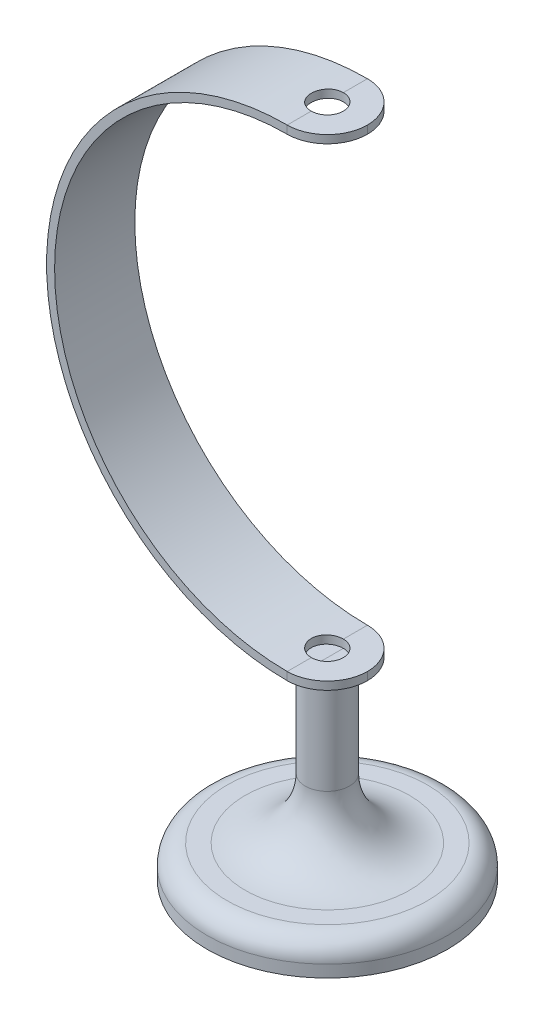
from build123d import *

# Parameters (mm, degrees)
BOSS_EXTRUDE1_DEPTH     = 10
CUT_EXTRUDE1_DEPTH      = 135.536240471
CUT_EXTRUDE1_DEPTH_BACK = 135.536240471
SKETCH3_R               = 4
FILLET1_R               = 10
BOSS_EXTRUDE2_OUTLINE_R = 5.5
BOSS_EXTRUDE2_DEPTH     = 40
BOSS_EXTRUDE2_START     = -5.5
BOSS_EXTRUDE2_2_DEPTH   = 11
SKETCH5_R               = 30
BOSS_EXTRUDE3_DEPTH     = 8
FILLET2_R               = 15
FILLET3_R               = 5


with BuildPart() as part:
    # Sketch2 → Boss-Extrude1 (new, symmetric)
    with BuildSketch(Plane.XY):
        with BuildLine():
            Line((0, 60), (10, 60))
            Line((10, 60), (10, 58))
            Line((10, 58), (0, 58))
            ThreePointArc((0, 58), (-58, 0), (0, -58))
            Line((0, -58), (10, -58))
            Line((10, -58), (10, -60))
            Line((10, -60), (0, -60))
            ThreePointArc((0, -60), (-60, 0), (0, 60))
        make_face()
    extrude(amount=BOSS_EXTRUDE1_DEPTH, both=True)

    # Sketch3 → Cut-Extrude1 (cut, two sides: drawn at the far end of the back side and taken through both)
    with BuildSketch(Plane(origin=(0, 60, 0), x_dir=(1, 0, 0), z_dir=(0, 1, 0)).offset(-CUT_EXTRUDE1_DEPTH_BACK)):
        with Locations(Location((0, 0, 0), (0, 0, 270))):
            Circle(SKETCH3_R)
    extrude(amount=CUT_EXTRUDE1_DEPTH + CUT_EXTRUDE1_DEPTH_BACK, mode=Mode.SUBTRACT)

    # Fillet1
    fillet1_edges = [part.edges().sort_by_distance(p)[0] for p in [
        (10, -59, -10),
        (10, -59, 10),
        (10, 59, -10),
        (10, 59, 10),
    ]]
    fillet(fillet1_edges, radius=FILLET1_R - 0.0001)  # a hair under: the kernel refuses the full size

    # Boss-Extrude2: read off the stored shape, not the designer's step
    # Boss-Extrude2 outline → Boss-Extrude2 (add)
    with BuildSketch(Plane.XZ.offset(60)):
        Circle(BOSS_EXTRUDE2_OUTLINE_R)
    extrude(amount=BOSS_EXTRUDE2_DEPTH)

    # Boss-Extrude2 2 outline → Boss-Extrude2 2 (add)
    with BuildSketch(Plane.XY.offset(BOSS_EXTRUDE2_START)):
        with BuildLine():
            Line((5, -59.799688591), (4.000851892, -59.866461263))
            ThreePointArc((4.000851892, -59.866461263), (2.001539936, -59.966606023), (0, -60))
            Line((0, -60), (5, -60))
            Line((5, -60), (5, -59.799688591))
        make_face()
    extrude(amount=BOSS_EXTRUDE2_2_DEPTH)

    # Sketch5 → Boss-Extrude3 (add)
    with BuildSketch(Plane.XZ.offset(100)):
        with Locations(Location((0, 0, 0), (0, 0, 270))):
            Circle(SKETCH5_R)
    extrude(amount=BOSS_EXTRUDE3_DEPTH)

    # Fillet2
    fillet2_edges = [part.edges().sort_by_distance(p)[0] for p in [
        (-5.5, -100, 0),
    ]]
    fillet(fillet2_edges, radius=FILLET2_R)

    # Fillet3
    fillet3_edges = [part.edges().sort_by_distance(p)[0] for p in [
        (0, -100, 30),
    ]]
    fillet(fillet3_edges, radius=FILLET3_R)


solid = part.part
